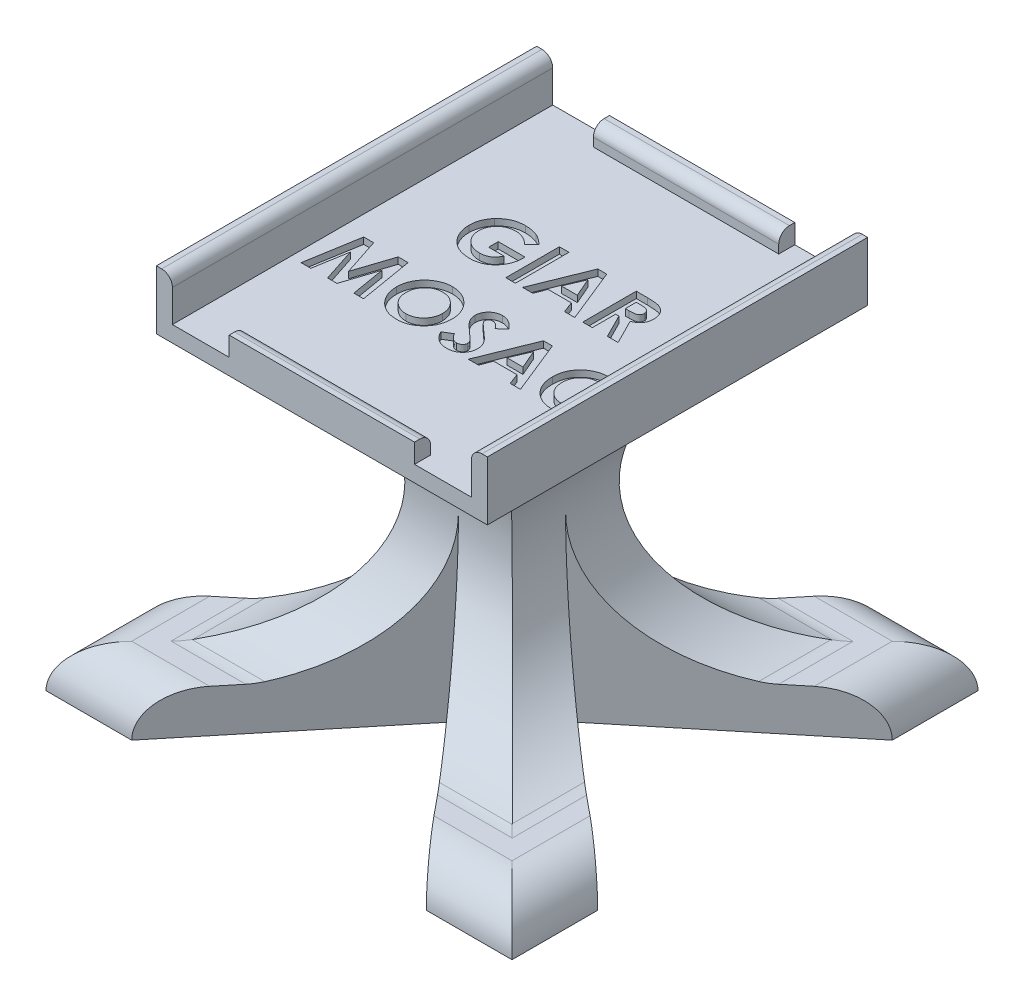
from build123d import *

# Parameters (mm, degrees)
SKETCH1_W                      = 154.5
SKETCH1_H                      = 177.5
SKETCH1_W_2                    = 139.5
SKETCH1_H_2                    = 162.5
BOSS_EXTRUDE1_DEPTH            = 7.5
BOSS_EXTRUDE2_START            = 7.5
SKETCH1_3_W                    = 154.5
SKETCH1_3_H                    = 177.5
SKETCH1_3_W_2                  = 139.5
SKETCH1_3_H_2                  = 162.5
BOSS_EXTRUDE2_DEPTH            = 20
CUT_EXTRUDE4_REACH             = 190.743
SKETCH5_W                      = 26.5
SKETCH5_H                      = 20
CUT_EXTRUDE4_DIRECTION_2_REACH = 190.743
SKETCH6_W                      = 86.5
SKETCH6_H                      = 7.5
CUT_EXTRUDE5_DEPTH             = 11
SKETCH7_W                      = 4.487179487
SKETCH7_H                      = 25
CUT_EXTRUDE6_DEPTH             = 3
FILLET2_R                      = 5
SKETCH1_4_W                    = 154.5
SKETCH1_4_H                    = 177.5
SKETCH1_4_W_2                  = 139.5
SKETCH1_4_H_2                  = 162.5
BOSS_EXTRUDE3_DEPTH            = 150
CUT_EXTRUDE1_REACH             = 246.896
CUT_EXTRUDE2_DEPTH             = 233.909451328
CUT_EXTRUDE3_REACH             = 214.956
BOSS_EXTRUDE4_DEPTH            = 20
FILLET1_R                      = 20


with BuildPart() as part:
    # Sketch1 → Boss-Extrude1 (new body)
    # profile 1 of 2: a face of its own
    with BuildSketch(Plane(origin=(0, 0, 0), x_dir=(1, 0, 0), z_dir=(0, 1, 0))):
        Rectangle(SKETCH1_W, SKETCH1_H)
        Rectangle(SKETCH1_W_2, SKETCH1_H_2, mode=Mode.SUBTRACT)
    # profile 2 of 2: a face of its own
    with BuildSketch(Plane(origin=(0, 0, 0), x_dir=(1, 0, 0), z_dir=(0, 1, 0))):
        Rectangle(SKETCH1_W_2, SKETCH1_H_2)
    extrude(amount=BOSS_EXTRUDE1_DEPTH)

    # Sketch1<3> → Boss-Extrude2 (add)
    with BuildSketch(Plane(origin=(0, 0, 0), x_dir=(1, 0, 0), z_dir=(0, 1, 0)).offset(BOSS_EXTRUDE2_START)):
        Rectangle(SKETCH1_3_W, SKETCH1_3_H)
        Rectangle(SKETCH1_3_W_2, SKETCH1_3_H_2, mode=Mode.SUBTRACT)
    extrude(amount=BOSS_EXTRUDE2_DEPTH)

    # Sketch5 → Cut-Extrude4 (cut, up to next)
    with BuildSketch(Plane.XY.offset(-81.25), mode=Mode.PRIVATE) as cut_extrude4_sk1:
        with Locations((-56.5, 17.5)):
            Rectangle(SKETCH5_W, SKETCH5_H)
    cut_extrude4_tool1 = extrude(cut_extrude4_sk1.sketch, amount=-CUT_EXTRUDE4_REACH, mode=Mode.PRIVATE) & part.part
    # Sketch5 → Cut-Extrude4 (cut, up to next)
    with BuildSketch(Plane.XY.offset(-81.25), mode=Mode.PRIVATE) as cut_extrude4_sk2:
        with Locations((56.5, 17.5)):
            Rectangle(SKETCH5_W, SKETCH5_H)
    cut_extrude4_tool2 = extrude(cut_extrude4_sk2.sketch, amount=-CUT_EXTRUDE4_REACH, mode=Mode.PRIVATE) & part.part
    add(cut_extrude4_tool1.solids().sort_by_distance((-56.5, 17.5, -81.25))[0], mode=Mode.SUBTRACT)
    add(cut_extrude4_tool2.solids().sort_by_distance((56.5, 17.5, -81.25))[0], mode=Mode.SUBTRACT)

    # Sketch5 → Cut-Extrude4 direction 2 (cut, up to next)
    with BuildSketch(Plane.XY.offset(-81.25), mode=Mode.PRIVATE) as cut_extrude4_direction_2_sk1:
        with Locations((-56.5, 17.5)):
            Rectangle(SKETCH5_W, SKETCH5_H)
    cut_extrude4_direction_2_tool1 = extrude(cut_extrude4_direction_2_sk1.sketch, amount=CUT_EXTRUDE4_DIRECTION_2_REACH, mode=Mode.PRIVATE) & part.part
    # Sketch5 → Cut-Extrude4 direction 2 (cut, up to next)
    with BuildSketch(Plane.XY.offset(-81.25), mode=Mode.PRIVATE) as cut_extrude4_direction_2_sk2:
        with Locations((56.5, 17.5)):
            Rectangle(SKETCH5_W, SKETCH5_H)
    cut_extrude4_direction_2_tool2 = extrude(cut_extrude4_direction_2_sk2.sketch, amount=CUT_EXTRUDE4_DIRECTION_2_REACH, mode=Mode.PRIVATE) & part.part
    add(cut_extrude4_direction_2_tool1.solids().sort_by_distance((-56.5, 17.5, -81.25))[0], mode=Mode.SUBTRACT)
    add(cut_extrude4_direction_2_tool2.solids().sort_by_distance((56.5, 17.5, -81.25))[0], mode=Mode.SUBTRACT)

    # Sketch6 → Cut-Extrude5 (cut)
    with BuildSketch(Plane(origin=(0, 27.5, 0), x_dir=(1, 0, 0), z_dir=(0, 1, 0))):
        with Locations((0, 85)):
            Rectangle(SKETCH6_W, SKETCH6_H)
        with Locations((0, -85)):
            Rectangle(SKETCH6_W, SKETCH6_H)
    extrude(amount=-CUT_EXTRUDE5_DEPTH, mode=Mode.SUBTRACT)

    # Sketch7 → Cut-Extrude6 (cut)
    # profile 1 of 9: a face of its own
    with BuildSketch(Plane(origin=(0, 7.5, 0), x_dir=(1, 0, 0), z_dir=(0, 1, 0))):
        with BuildLine():
            Line((-16.511418269, 29.023637821), (-19.906850962, 25.7734375))
            add(Edge.make_bspline(
                [(-19.906850962, 25.7734375), (-20.175673293, 26.042581928), (-20.703147087, 26.570687729), (-21.565764494, 27.258053723), (-22.45917433, 27.842450703), (-23.386317167, 28.322982778), (-24.348484518, 28.695725235), (-25.343777618, 28.96235984), (-26.373815678, 29.120505342), (-27.071105468, 29.142645174), (-27.423878205, 29.153846154)],
                knots=[0, 0, 0, 0, 1.075575784, 2.110457258, 3.113929901, 4.09197124, 5.059417775, 6.02750972, 7.002078037, 8, 8, 8, 8], degree=3))
            add(Edge.make_bspline(
                [(-27.423878205, 29.153846154), (-27.729721383, 29.145997678), (-28.330271272, 29.130586507), (-29.212721495, 29.013555131), (-30.055956738, 28.818059481), (-30.863960793, 28.5472329), (-31.631800515, 28.194801921), (-32.36392491, 27.766205903), (-33.055828479, 27.25816605), (-33.702062979, 26.680313032), (-34.290461571, 26.049414206), (-34.804164611, 25.374129373), (-35.24172924, 24.667045269), (-35.60193417, 23.924544347), (-35.876010951, 23.1477662), (-36.071665907, 22.337274728), (-36.195858152, 21.495425332), (-36.210521546, 20.921106955), (-36.217948718, 20.630208333)],
                knots=[0, 0, 0, 0, 1.075001177, 2.110859044, 3.123021556, 4.114053297, 5.101481495, 6.087880186, 7.091499647, 8.114004866, 9.131394192, 10.11971144, 11.092043119, 12.050101265, 13.015322563, 13.981809771, 14.977764287, 16, 16, 16, 16], degree=3))
            add(Edge.make_bspline(
                [(-36.217948718, 20.630208333), (-36.211021008, 20.32924132), (-36.19737247, 19.736295103), (-36.066262834, 18.866121038), (-35.864265867, 18.028950884), (-35.568596166, 17.230996248), (-35.204716308, 16.461326264), (-34.743256695, 15.734850176), (-34.205148608, 15.040473894), (-33.591353572, 14.390286909), (-32.92370308, 13.790970985), (-32.200615876, 13.273985642), (-31.444092704, 12.827938887), (-30.641923246, 12.474684275), (-29.808030789, 12.19105952), (-28.933957268, 11.991079728), (-28.021670888, 11.86839282), (-27.399226115, 11.853640631), (-27.083333333, 11.846153846)],
                knots=[0, 0, 0, 0, 1.022067601, 2.013613092, 2.983553406, 3.943623673, 4.90013463, 5.87121881, 6.861774014, 7.881098904, 8.905697761, 9.905387765, 10.89678721, 11.884561068, 12.87834324, 13.885584958, 14.926927371, 16, 16, 16, 16], degree=3))
            add(Edge.make_bspline(
                [(-27.083333333, 11.846153846), (-26.877856777, 11.848007826), (-26.474460577, 11.8516476), (-25.882747096, 11.91073137), (-25.316027705, 11.995198488), (-24.772107656, 12.107022922), (-24.256479082, 12.265274562), (-23.762002752, 12.450330367), (-23.291575863, 12.668733117), (-22.847749019, 12.928018111), (-22.42391679, 13.218644896), (-22.024046327, 13.55118374), (-21.641123433, 13.918137117), (-21.279622512, 14.323987879), (-20.945662074, 14.772364815), (-20.628542872, 15.255028398), (-20.331895866, 15.776768773), (-20.156614977, 16.145195397), (-20.067107372, 16.333333333)],
                knots=[0, 0, 0, 0, 1.109579412, 2.178351274, 3.208885622, 4.204702371, 5.174744997, 6.119429583, 7.05542196, 7.97267548, 8.893247984, 9.828544973, 10.778894627, 11.756245826, 12.760884819, 13.796418446, 14.874735809, 16, 16, 16, 16], degree=3))
            Line((-20.067107372, 16.333333333), (-27.243589744, 16.333333333))
            Line((-27.243589744, 16.333333333), (-27.243589744, 20.820512821))
            Line((-27.243589744, 20.820512821), (-14.778645833, 20.820512821))
            Line((-14.778645833, 20.820512821), (-14.743589744, 19.75380609))
            add(Edge.make_bspline(
                [(-14.743589744, 19.75380609), (-14.74809419, 19.479848736), (-14.757095045, 18.932422929), (-14.839353417, 18.11739916), (-14.975613157, 17.313184991), (-15.161893264, 16.520588155), (-15.395349361, 15.73572068), (-15.693078965, 14.966098326), (-16.041718511, 14.206501769), (-16.432344388, 13.460158708), (-16.871295481, 12.744022248), (-17.343890786, 12.065935556), (-17.843393134, 11.427072254), (-18.380666495, 10.836333308), (-18.947344639, 10.28875625), (-19.544543077, 9.786447675), (-20.17437407, 9.328982567), (-20.833501153, 8.912496392), (-21.525678687, 8.547470833), (-22.247101084, 8.229947022), (-22.996679093, 7.960280754), (-23.776347949, 7.739213077), (-24.584573458, 7.568641777), (-25.421372935, 7.451680813), (-26.287205959, 7.372204523), (-26.874482184, 7.363437729), (-27.173477564, 7.358974359)],
                knots=[0, 0, 0, 0, 1.006889344, 2.011981806, 3.007738725, 4.003571281, 5.003404394, 6.015442001, 7.03424805, 8.074616296, 9.110249922, 10.119753985, 11.111721717, 12.089233633, 13.052717867, 14.006597561, 14.955430184, 15.912305663, 16.870361111, 17.829300583, 18.807640451, 19.796414044, 20.806216501, 21.841577364, 22.90109906, 24, 24, 24, 24], degree=3))
            add(Edge.make_bspline(
                [(-27.173477564, 7.358974359), (-27.492485363, 7.36338202), (-28.124853968, 7.372119317), (-29.059895704, 7.453950059), (-29.967811296, 7.589006416), (-30.848827202, 7.775919798), (-31.704988962, 8.008548433), (-32.534825557, 8.300552398), (-33.336639749, 8.647900348), (-34.112832595, 9.041394376), (-34.853483504, 9.487650879), (-35.55693256, 9.978844699), (-36.219340203, 10.518135457), (-36.84749154, 11.096495313), (-37.426710531, 11.728140405), (-37.978582401, 12.392596052), (-38.476370847, 13.114231836), (-38.941479298, 13.869652114), (-39.35468536, 14.658540324), (-39.716040003, 15.466305573), (-40.024203037, 16.288270894), (-40.267197038, 17.128263636), (-40.464485409, 17.980426664), (-40.605648942, 18.848465839), (-40.685370584, 19.732272501), (-40.698513094, 20.326236359), (-40.705128205, 20.625200321)],
                knots=[0, 0, 0, 0, 1.084149091, 2.14910686, 3.187506334, 4.202448172, 5.208724393, 6.201130722, 7.189831603, 8.176984443, 9.156919086, 10.126598231, 11.090766514, 12.05840148, 13.026036446, 14.001772938, 14.991905635, 16.003017641, 17.015720547, 18.016462227, 19.009322657, 19.99686681, 20.986544154, 21.980959929, 22.983742515, 24, 24, 24, 24], degree=3))
            add(Edge.make_bspline(
                [(-40.705128205, 20.625200321), (-40.696269159, 21.03305105), (-40.678775169, 21.838435322), (-40.516754275, 23.024771464), (-40.26418784, 24.17243331), (-39.901729577, 25.277241153), (-39.436610034, 26.340716877), (-38.87541805, 27.365357044), (-38.205963317, 28.350072551), (-37.687759374, 28.959748213), (-37.424879808, 29.269030449)],
                knots=[0, 0, 0, 0, 1.034044851, 2.041932006, 3.031217818, 4.011390712, 4.986069675, 5.97149666, 6.970960976, 8, 8, 8, 8], degree=3))
            add(Edge.make_bspline(
                [(-37.424879808, 29.269030449), (-37.261660453, 29.447959596), (-36.937672489, 29.803131263), (-36.419778318, 30.296649521), (-35.888750205, 30.760574941), (-35.337233327, 31.185070277), (-34.768126907, 31.579427934), (-34.179792954, 31.936255365), (-33.575317734, 32.266914143), (-32.949987071, 32.554519578), (-32.307074659, 32.812381843), (-31.643733138, 33.030569575), (-30.964930801, 33.223832046), (-30.264656831, 33.370855219), (-29.549985665, 33.493284897), (-28.815844327, 33.575343679), (-28.064233399, 33.635486925), (-27.555881569, 33.639164799), (-27.298677885, 33.641025641)],
                knots=[0, 0, 0, 0, 1.020590567, 2.025856924, 3.013483481, 3.991664875, 4.957826714, 5.930500614, 6.890802512, 7.860442893, 8.829981142, 9.809047939, 10.802672283, 11.803273349, 12.823572789, 13.857849586, 14.916166035, 16, 16, 16, 16], degree=3))
            add(Edge.make_bspline(
                [(-27.298677885, 33.641025641), (-27.029816529, 33.636879336), (-26.494881155, 33.628629713), (-25.69952084, 33.571547702), (-24.91521259, 33.483483613), (-24.145261556, 33.35138245), (-23.38708378, 33.188474222), (-22.64460377, 32.979748461), (-21.912977764, 32.742598399), (-21.436692005, 32.553524849), (-21.198918269, 32.459134615)],
                knots=[0, 0, 0, 0, 1.03180557, 2.052914215, 3.058998889, 4.059601663, 5.049854447, 6.033765722, 7.018406786, 8, 8, 8, 8], degree=3))
            add(Edge.make_bspline(
                [(-21.198918269, 32.459134615), (-20.998861083, 32.371901049), (-20.591950302, 32.194470388), (-19.999945268, 31.869852673), (-19.406493802, 31.509976679), (-18.81799955, 31.101684504), (-18.23535921, 30.645739844), (-17.652489398, 30.149344268), (-17.075340258, 29.606709518), (-16.701826662, 29.220512117), (-16.511418269, 29.023637821)],
                knots=[0, 0, 0, 0, 0.894392155, 1.819168899, 2.76525314, 3.739198753, 4.75366411, 5.797420238, 6.877176959, 8, 8, 8, 8], degree=3))
        make_face()
    # profile 2 of 9: a face of its own
    with BuildSketch(Plane(origin=(0, 7.5, 0), x_dir=(1, 0, 0), z_dir=(0, 1, 0))):
        with Locations((-8.653846154, 20.5)):
            Rectangle(SKETCH7_W, SKETCH7_H)
    # profile 3 of 9: a face of its own
    with BuildSketch(Plane(origin=(0, 7.5, 0), x_dir=(1, 0, 0), z_dir=(0, 1, 0))):
        Polygon((7.056290064, 33), (11.217948718, 33), (21.314102564, 8), (16.521434295, 8), (14.578325321, 13.128205128), (3.685897436, 13.128205128), (1.742788462, 8), (-3.044871795, 8), align=None)
        Polygon((9.134615385, 26.294270833), (5.388621795, 17.615384615), (12.880608974, 17.615384615), align=None, mode=Mode.SUBTRACT)
    # profile 4 of 9: a face of its own
    with BuildSketch(Plane(origin=(0, 7.5, 0), x_dir=(1, 0, 0), z_dir=(0, 1, 0))):
        with BuildLine():
            Line((25, 33), (30.228365385, 33))
            add(Edge.make_bspline(
                [(30.228365385, 33), (30.573958745, 32.998773342), (31.238632126, 32.996414133), (32.197054837, 32.959192064), (33.077497901, 32.907394499), (33.881264895, 32.828350041), (34.608011954, 32.723546644), (35.258467447, 32.600000781), (35.832612363, 32.459193783), (36.335288822, 32.283737155), (36.788929468, 32.085824738), (37.211785619, 31.858419741), (37.61318611, 31.604054392), (37.990448011, 31.31603565), (38.346849818, 30.999544901), (38.683063904, 30.654263565), (38.994339252, 30.277263799), (39.278748433, 29.870927764), (39.537964508, 29.443471573), (39.767057151, 28.994308325), (39.953355669, 28.523125659), (40.117970381, 28.036733181), (40.236537025, 27.528177816), (40.318998391, 27.002410437), (40.379373378, 26.457580286), (40.382844651, 26.087446872), (40.384615385, 25.898637821)],
                knots=[0, 0, 0, 0, 1.749336639, 3.364467119, 4.854658419, 6.213483162, 7.451590619, 8.570285859, 9.5643256, 10.440900261, 11.26203566, 12.067320669, 12.869050712, 13.665104639, 14.467235401, 15.27997916, 16.102287765, 16.939272006, 17.78853747, 18.631303466, 19.488103222, 20.351255419, 21.228522269, 22.127379805, 23.044756219, 24, 24, 24, 24], degree=3))
            add(Edge.make_bspline(
                [(40.384615385, 25.898637821), (40.380015655, 25.701564545), (40.370996423, 25.31513977), (40.322413933, 24.747513292), (40.233620404, 24.204447981), (40.099129685, 23.687533867), (39.944550073, 23.190337349), (39.738998841, 22.722032016), (39.50701396, 22.275807044), (39.231492294, 21.857974455), (38.929120727, 21.459253351), (38.577468954, 21.094920219), (38.199318609, 20.74539353), (37.773412485, 20.432566452), (37.318524918, 20.135286748), (36.825617773, 19.865872167), (36.297907928, 19.617550247), (35.926901774, 19.479068792), (35.737179487, 19.408253205)],
                knots=[0, 0, 0, 0, 1.099860209, 2.156625411, 3.176576793, 4.16617041, 5.135385252, 6.078461593, 7.016046972, 7.938469504, 8.868247731, 9.803980173, 10.76021508, 11.73834243, 12.748633912, 13.790971185, 14.870363756, 16, 16, 16, 16], degree=3))
            Line((35.737179487, 19.408253205), (41.506410256, 8))
            Line((41.506410256, 8), (36.518429487, 8))
            Line((36.518429487, 8), (31.009615385, 18.897435897))
            Line((31.009615385, 18.897435897), (29.487179487, 18.897435897))
            Line((29.487179487, 18.897435897), (29.487179487, 8))
            Line((29.487179487, 8), (25, 8))
            Line((25, 8), (25, 33))
        make_face()
        with BuildLine():
            Line((29.487179487, 23.384615385), (31.234975962, 23.384615385))
            add(Edge.make_bspline(
                [(31.234975962, 23.384615385), (31.448658609, 23.387022022), (31.857814965, 23.391630216), (32.446235543, 23.413004929), (32.980661758, 23.464507426), (33.463388618, 23.529578907), (33.89684516, 23.604713328), (34.277165105, 23.712385515), (34.610208601, 23.827758989), (34.892029072, 23.971138289), (35.132810007, 24.134191651), (35.340708933, 24.319424324), (35.512671154, 24.533807556), (35.654204833, 24.771515337), (35.764302648, 25.034650133), (35.844665618, 25.32032332), (35.889576635, 25.631789084), (35.8947438, 25.846742871), (35.897435897, 25.958733974)],
                knots=[0, 0, 0, 0, 1.688639943, 3.233382647, 4.650958383, 5.928841754, 7.082724185, 8.122798841, 9.049171256, 9.863274652, 10.613301712, 11.341792392, 12.054588806, 12.776240173, 13.521029143, 14.301969904, 15.115324896, 16, 16, 16, 16], degree=3))
            add(Edge.make_bspline(
                [(35.897435897, 25.958733974), (35.89234624, 26.091227625), (35.882348552, 26.35148685), (35.783140428, 26.726168876), (35.625222523, 27.072962726), (35.408760328, 27.390301499), (35.136154336, 27.668502575), (34.823317451, 27.913739039), (34.4634979, 28.107653684), (34.130332072, 28.23555772), (33.827229044, 28.312084024), (33.553688124, 28.369110749), (33.236926091, 28.409527226), (32.876703808, 28.452396094), (32.473939493, 28.480194384), (32.026437841, 28.500481596), (31.535484072, 28.508782091), (31.193242666, 28.511435613), (31.014623397, 28.512820513)],
                knots=[0, 0, 0, 0, 1.020303359, 2.004196876, 2.966617323, 3.9489082, 4.950758222, 5.960522915, 7.003732012, 8.091992268, 8.70421221, 9.413913587, 10.24622431, 11.166358409, 12.212345909, 13.359657661, 14.621978493, 16, 16, 16, 16], degree=3))
            Line((31.014623397, 28.512820513), (29.487179487, 28.512820513))
            Line((29.487179487, 28.512820513), (29.487179487, 23.384615385))
        make_face(mode=Mode.SUBTRACT)
    # profile 5 of 9: a face of its own
    with BuildSketch(Plane(origin=(0, 7.5, 0), x_dir=(1, 0, 0), z_dir=(0, 1, 0))):
        Polygon((-60.521834936, -8.705128205), (-55.864383013, -8.705128205), (-50.16025641, -26.143028846), (-44.416065705, -8.705128205), (-39.803685897, -8.705128205), (-35.576923077, -33.705128205), (-40.119190705, -33.705128205), (-42.788461538, -17.914863782), (-47.986778846, -33.705128205), (-52.363782051, -33.705128205), (-57.532051282, -17.914863782), (-60.196314103, -33.705128205), (-64.743589744, -33.705128205), align=None)
    # profile 6 of 9: a face of its own
    with BuildSketch(Plane(origin=(0, 7.5, 0), x_dir=(1, 0, 0), z_dir=(0, 1, 0))):
        with BuildLine():
            add(Edge.make_bspline(
                [(-19.661458333, -8.064102564), (-19.226802694, -8.075356577), (-18.368694015, -8.097574547), (-17.106725807, -8.282778671), (-15.890586102, -8.584542239), (-14.720824835, -9.004015424), (-13.600370952, -9.552559693), (-12.525272238, -10.214623455), (-11.499379646, -11.002702768), (-10.533205701, -11.898413041), (-9.640286722, -12.872458851), (-8.866571906, -13.921192338), (-8.206776295, -15.017439763), (-7.659935927, -16.164138553), (-7.243415203, -17.369230144), (-6.951125383, -18.626570161), (-6.763343655, -19.935800903), (-6.741745867, -20.827208589), (-6.730769231, -21.280248397)],
                knots=[0, 0, 0, 0, 1.014329547, 2.002516266, 2.970391464, 3.935626869, 4.897733899, 5.877609409, 6.878433252, 7.912639331, 8.949961323, 9.958554974, 10.949718813, 11.932905612, 12.9188844, 13.919928257, 14.942845884, 16, 16, 16, 16], degree=3))
            add(Edge.make_bspline(
                [(-6.730769231, -21.280248397), (-6.742458873, -21.728183494), (-6.765493689, -22.610853972), (-6.943459311, -23.908019638), (-7.240671328, -25.151890924), (-7.650127534, -26.345283362), (-8.187050285, -27.482416567), (-8.833979163, -28.570550978), (-9.607985391, -29.599588446), (-10.480837924, -30.568976751), (-11.441772813, -31.448904646), (-12.459555407, -32.224339584), (-13.529486214, -32.881413887), (-14.649999198, -33.419826585), (-15.823497245, -33.83766885), (-17.047081671, -34.132486931), (-18.320676761, -34.311653831), (-19.186783184, -34.334538185), (-19.626402244, -34.346153846)],
                knots=[0, 0, 0, 0, 1.051557043, 2.072126891, 3.067553643, 4.050577992, 5.02905126, 6.015227836, 7.017913613, 8.04756643, 9.074058332, 10.072836633, 11.047628519, 12.017157415, 12.98668631, 13.966869689, 14.968021931, 16, 16, 16, 16], degree=3))
            add(Edge.make_bspline(
                [(-19.626402244, -34.346153846), (-20.086191067, -34.335734026), (-20.989613257, -34.315260503), (-22.311775677, -34.120566651), (-23.57852152, -33.827289698), (-24.779209391, -33.389589578), (-25.92606727, -32.842427624), (-27.010668855, -32.168564873), (-28.03264965, -31.369114935), (-28.986147404, -30.46455202), (-29.850018679, -29.474761791), (-30.612554527, -28.429136187), (-31.255770431, -27.33566287), (-31.779689924, -26.193830069), (-32.192727007, -25.010733998), (-32.484077739, -23.77916926), (-32.656185569, -22.502089596), (-32.68015919, -21.634671559), (-32.692307692, -21.195112179)],
                knots=[0, 0, 0, 0, 1.067978421, 2.098431617, 3.099715153, 4.085208694, 5.062210972, 6.048429807, 7.046490867, 8.072918869, 9.098532598, 10.095778865, 11.076610158, 12.041847152, 13.011192615, 13.984257998, 14.978533688, 16, 16, 16, 16], degree=3))
            add(Edge.make_bspline(
                [(-32.692307692, -21.195112179), (-32.688494792, -20.89939964), (-32.680917273, -20.31171896), (-32.589638065, -19.440806191), (-32.458222249, -18.58689247), (-32.263864494, -17.753382364), (-32.027769497, -16.934395845), (-31.721875077, -16.137556244), (-31.373684445, -15.354351123), (-30.966856475, -14.594031113), (-30.514503109, -13.863591796), (-30.020945313, -13.16647878), (-29.484942042, -12.511121181), (-28.90821994, -11.893212259), (-28.288791545, -11.316813574), (-27.634804797, -10.7737654), (-26.933576162, -10.278493028), (-26.200453333, -9.818900918), (-25.43956949, -9.403299744), (-24.65402212, -9.049552454), (-23.85999505, -8.740630971), (-23.046881149, -8.496816477), (-22.223394379, -8.298232122), (-21.380737452, -8.166904881), (-20.526523295, -8.075628201), (-19.950497645, -8.067953561), (-19.661458333, -8.064102564)],
                knots=[0, 0, 0, 0, 1.034744296, 2.056386356, 3.06226378, 4.057406941, 5.050368692, 6.043467995, 7.042652155, 8.049140477, 9.059438543, 10.048523776, 11.036952808, 12.020949711, 13.004946614, 13.997082645, 14.994316842, 16.007702937, 17.024872941, 18.026463647, 19.021641123, 20.005082605, 20.995858141, 21.984425357, 22.988620895, 24, 24, 24, 24], degree=3))
        make_face()
        with BuildLine():
            add(Edge.make_bspline(
                [(-19.731570513, -12.551282051), (-20.0240937, -12.559131105), (-20.601417416, -12.574621997), (-21.448246166, -12.692641638), (-22.261231672, -12.88113242), (-23.035867233, -13.154159015), (-23.775510189, -13.501652576), (-24.481471695, -13.922398918), (-25.143975646, -14.430860725), (-25.771855891, -14.999740952), (-26.339042373, -15.633604262), (-26.840169522, -16.312896597), (-27.259532231, -17.036483553), (-27.610751127, -17.797643176), (-27.875141114, -18.604934505), (-28.063458175, -19.452033939), (-28.182467528, -20.340401075), (-28.197468805, -20.945999794), (-28.205128205, -21.255208333)],
                knots=[0, 0, 0, 0, 1.033739768, 2.040188636, 3.016340934, 3.979330865, 4.937572243, 5.900995986, 6.878200029, 7.884839167, 8.891893314, 9.879764717, 10.863503415, 11.843163062, 12.837761627, 13.859916423, 14.907309254, 16, 16, 16, 16], degree=3))
            add(Edge.make_bspline(
                [(-28.205128205, -21.255208333), (-28.19497301, -21.59788095), (-28.17507051, -22.269462501), (-28.0350341, -23.249147574), (-27.795445743, -24.174362891), (-27.449484813, -25.040583364), (-27.020402496, -25.857427721), (-26.487550359, -26.614884373), (-25.859558082, -27.317488619), (-25.37575792, -27.727698243), (-25.130208333, -27.935897436)],
                knots=[0, 0, 0, 0, 1.078454662, 2.113592447, 3.107694534, 4.079536787, 5.043276885, 6.005368276, 6.987637804, 8, 8, 8, 8], degree=3))
            add(Edge.make_bspline(
                [(-25.130208333, -27.935897436), (-24.929056344, -28.089707003), (-24.531284353, -28.393860783), (-23.896353655, -28.783696246), (-23.242500059, -29.117824127), (-22.564789421, -29.387795502), (-21.86465303, -29.600150448), (-21.142186897, -29.748859125), (-20.398414695, -29.84218668), (-19.895441076, -29.853341091), (-19.641426282, -29.858974359)],
                knots=[0, 0, 0, 0, 1.023928204, 2.024787132, 3.009472467, 3.9914905, 4.972207045, 5.96565515, 6.972602802, 8, 8, 8, 8], degree=3))
            add(Edge.make_bspline(
                [(-19.641426282, -29.858974359), (-19.353933038, -29.851058754), (-18.788281038, -29.835484552), (-17.957216462, -29.718917797), (-17.161031357, -29.521644761), (-16.394782939, -29.251013252), (-15.660680724, -28.899156609), (-14.962312472, -28.465360036), (-14.298453751, -27.954949995), (-13.671373418, -27.378599125), (-13.09819235, -26.742238832), (-12.598110949, -26.059323221), (-12.165414602, -25.344898967), (-11.821499308, -24.588854477), (-11.54666387, -23.798326458), (-11.360613303, -22.969813831), (-11.240598591, -22.106732041), (-11.225593087, -21.519374381), (-11.217948718, -21.220152244)],
                knots=[0, 0, 0, 0, 1.026359118, 2.019393844, 2.989460624, 3.950973911, 4.916101784, 5.890408035, 6.881132271, 7.902007068, 8.92769091, 9.933912415, 10.920395702, 11.90457117, 12.894218921, 13.903490204, 14.931958862, 16, 16, 16, 16], degree=3))
            add(Edge.make_bspline(
                [(-11.217948718, -21.220152244), (-11.225857583, -20.922650716), (-11.241424979, -20.33706433), (-11.358196898, -19.476201516), (-11.55421888, -18.65134653), (-11.825663066, -17.861152295), (-12.172282919, -17.104844129), (-12.60091353, -16.385081657), (-13.110050888, -15.702560714), (-13.687977229, -15.061932419), (-14.31701453, -14.473236052), (-14.992348926, -13.96235462), (-15.695083802, -13.518414898), (-16.441343325, -13.170650446), (-17.215859649, -12.893587245), (-18.023358915, -12.689553928), (-18.866899575, -12.57545109), (-19.440777728, -12.55941021), (-19.731570513, -12.551282051)],
                knots=[0, 0, 0, 0, 1.055025985, 2.07665775, 3.074803781, 4.057872707, 5.035505728, 6.020516407, 7.023567878, 8.050795229, 9.077271434, 10.074415901, 11.050397877, 12.019801805, 12.988065821, 13.964604439, 14.968634123, 16, 16, 16, 16], degree=3))
        make_face(mode=Mode.SUBTRACT)
    # profile 7 of 9: a face of its own
    with BuildSketch(Plane(origin=(0, 7.5, 0), x_dir=(1, 0, 0), z_dir=(0, 1, 0))):
        with BuildLine():
            Line((10.576923077, -12.045472756), (7.221554487, -15.115384615))
            add(Edge.make_bspline(
                [(7.221554487, -15.115384615), (7.077824884, -14.912639068), (6.80188409, -14.523395891), (6.354612845, -14.002190104), (5.909361259, -13.557562779), (5.462004347, -13.191371365), (5.008576906, -12.905840747), (4.549866022, -12.703681915), (4.088472255, -12.575167627), (3.778486866, -12.559164506), (3.625801282, -12.551282051)],
                knots=[0, 0, 0, 0, 1.299362458, 2.494594718, 3.587462134, 4.587049575, 5.512617175, 6.380583204, 7.202344345, 8, 8, 8, 8], degree=3))
            add(Edge.make_bspline(
                [(3.625801282, -12.551282051), (3.483380549, -12.556276736), (3.208403533, -12.565920161), (2.816403395, -12.661775082), (2.468380091, -12.827206598), (2.164673275, -13.043522224), (1.924092668, -13.304132402), (1.73200771, -13.577445471), (1.623847738, -13.879121287), (1.609611757, -14.086324408), (1.602564103, -14.188902244)],
                knots=[0, 0, 0, 0, 1.185010067, 2.2879431, 3.333075148, 4.379039566, 5.372662701, 6.27520591, 7.14612461, 8, 8, 8, 8], degree=3))
            add(Edge.make_bspline(
                [(1.602564103, -14.188902244), (1.606980511, -14.292959298), (1.615874543, -14.502515743), (1.701778784, -14.809646813), (1.831261006, -15.109749621), (1.954986554, -15.29243648), (2.018229167, -15.385817308)],
                knots=[0, 0, 0, 0, 0.967525499, 1.948461899, 2.951351359, 4, 4, 4, 4], degree=3))
            add(Edge.make_bspline(
                [(2.018229167, -15.385817308), (2.075723542, -15.458401248), (2.208068003, -15.625479893), (2.460421782, -15.890106423), (2.777325131, -16.214297085), (3.170973156, -16.586903912), (3.625024446, -17.021327304), (4.160524865, -17.500489911), (4.762060375, -18.039230842), (5.189617879, -18.414390518), (5.413661859, -18.610977564)],
                knots=[0, 0, 0, 0, 0.473873513, 1.090794244, 1.870441696, 2.795289791, 3.865433203, 5.087734844, 6.473946851, 8, 8, 8, 8], degree=3))
            add(Edge.make_bspline(
                [(5.413661859, -18.610977564), (5.623959362, -18.792979446), (6.023060333, -19.138381205), (6.59090176, -19.628623544), (7.089939801, -20.069682624), (7.527444302, -20.454939089), (7.896783121, -20.788435164), (8.19950896, -21.071764955), (8.439319102, -21.299412553), (8.575637127, -21.436911841), (8.633814103, -21.495592949)],
                knots=[0, 0, 0, 0, 1.543621617, 2.929473131, 4.163658386, 5.240097082, 6.164993805, 6.925417477, 7.541396219, 8, 8, 8, 8], degree=3))
            add(Edge.make_bspline(
                [(8.633814103, -21.495592949), (8.85452542, -21.734449864), (9.278810083, -22.193616738), (9.830230575, -22.905180987), (10.284067476, -23.599812785), (10.635164309, -24.290582756), (10.900326759, -24.987457336), (11.087269798, -25.707527336), (11.199231228, -26.458317037), (11.211661561, -26.970639353), (11.217948718, -27.229767628)],
                knots=[0, 0, 0, 0, 1.206664779, 2.319633467, 3.337109185, 4.282041471, 5.190008762, 6.099243693, 7.03861361, 8, 8, 8, 8], degree=3))
            add(Edge.make_bspline(
                [(11.217948718, -27.229767628), (11.213473681, -27.482256353), (11.204693491, -27.977648627), (11.097153008, -28.70258143), (10.943806591, -29.396373584), (10.706706128, -30.051475651), (10.417729488, -30.678640932), (10.055455534, -31.268100184), (9.63001445, -31.825818978), (9.142393644, -32.341827407), (8.60302713, -32.810069291), (8.024505283, -33.226909275), (7.401171026, -33.571063778), (6.738350028, -33.854450463), (6.036397082, -34.072718677), (5.296148426, -34.234039229), (4.516471799, -34.330861282), (3.983317686, -34.340982879), (3.7109375, -34.346153846)],
                knots=[0, 0, 0, 0, 1.043214005, 2.046824704, 3.02475056, 3.976699089, 4.921714032, 5.875962561, 6.831408892, 7.817874052, 8.806269674, 9.781291748, 10.760897367, 11.74438705, 12.757449933, 13.795994037, 14.874007457, 16, 16, 16, 16], degree=3))
            add(Edge.make_bspline(
                [(3.7109375, -34.346153846), (3.497121373, -34.342360606), (3.073642818, -34.334847814), (2.44949945, -34.273512123), (1.846818474, -34.174522844), (1.266278754, -34.032641637), (0.705264857, -33.852858904), (0.163753742, -33.633261183), (-0.354516358, -33.370444791), (-0.853466921, -33.069814278), (-1.330672433, -32.720742653), (-1.792166968, -32.33036657), (-2.233366525, -31.892681871), (-2.656390096, -31.408723663), (-3.058531059, -30.877121492), (-3.452952929, -30.305278903), (-3.822126412, -29.682583274), (-4.050181295, -29.245757253), (-4.166666667, -29.022636218)],
                knots=[0, 0, 0, 0, 1.016823716, 2.013894106, 2.979844003, 3.91962641, 4.853723003, 5.779685073, 6.695824784, 7.614987388, 8.547259901, 9.504950863, 10.487499108, 11.500346958, 12.559593716, 13.656357062, 14.802919212, 16, 16, 16, 16], degree=3))
            Line((-4.166666667, -29.022636218), (-0.220352564, -26.653846154))
            add(Edge.make_bspline(
                [(-0.220352564, -26.653846154), (-0.074646774, -26.907117681), (0.204683679, -27.392660844), (0.678035245, -28.045049623), (1.162959759, -28.603712622), (1.670668241, -29.058775437), (2.194987147, -29.416322842), (2.738449058, -29.671851023), (3.3014358, -29.830022678), (3.684916792, -29.84933909), (3.876201923, -29.858974359)],
                knots=[0, 0, 0, 0, 1.283663364, 2.460892379, 3.537111102, 4.529833553, 5.449777664, 6.316464042, 7.160231139, 8, 8, 8, 8], degree=3))
            add(Edge.make_bspline(
                [(3.876201923, -29.858974359), (4.070766287, -29.851105676), (4.44824949, -29.835839285), (4.987058457, -29.694828234), (5.481058919, -29.473430539), (5.90806927, -29.157526559), (6.269634713, -28.792925352), (6.536490764, -28.387289839), (6.704131534, -27.948402004), (6.721855228, -27.643521645), (6.730769231, -27.490184295)],
                knots=[0, 0, 0, 0, 1.13588714, 2.203786484, 3.234766741, 4.283437687, 5.291419208, 6.222934724, 7.106237994, 8, 8, 8, 8], degree=3))
            add(Edge.make_bspline(
                [(6.730769231, -27.490184295), (6.722537514, -27.347528843), (6.705815571, -27.057737949), (6.582646886, -26.626865488), (6.390096664, -26.196188979), (6.162296173, -25.842936455), (5.930480649, -25.547167692), (5.708812722, -25.290897439), (5.438879825, -25.007763673), (5.121366389, -24.697410235), (4.760467595, -24.357105004), (4.355879432, -23.986881304), (3.902968938, -23.590000364), (3.582850908, -23.319648989), (3.415464744, -23.178285256)],
                knots=[0, 0, 0, 0, 0.916159276, 1.861089862, 2.860218735, 3.940849679, 4.552606315, 5.27541173, 6.11797699, 7.06649574, 8.129236253, 9.306560635, 10.591630461, 12, 12, 12, 12], degree=3))
            add(Edge.make_bspline(
                [(3.415464744, -23.178285256), (3.097256984, -22.909050978), (2.486519978, -22.392308906), (1.623471103, -21.629097133), (0.845786791, -20.915805799), (0.160183958, -20.243617063), (-0.442073037, -19.624944694), (-0.956905447, -19.054763599), (-1.378657605, -18.528675608), (-1.82246081, -17.905559589), (-2.244162587, -17.146249904), (-2.608632591, -16.23271233), (-2.845085346, -15.31929067), (-2.871576589, -14.706069678), (-2.884615385, -14.404246795)],
                knots=[0, 0, 0, 0, 1.345494975, 2.582412109, 3.71882943, 4.751509156, 5.681369928, 6.505683931, 7.230279997, 7.856715994, 8.973648664, 10.023341002, 11.027102913, 12, 12, 12, 12], degree=3))
            add(Edge.make_bspline(
                [(-2.884615385, -14.404246795), (-2.879192567, -14.190210206), (-2.868509033, -13.768535136), (-2.773210267, -13.148523384), (-2.630782629, -12.550264139), (-2.42393681, -11.975940123), (-2.155475912, -11.4262707), (-1.82944058, -10.898565007), (-1.440768102, -10.397679928), (-1.002760458, -9.923947514), (-0.520188177, -9.491009998), (-0.004498369, -9.10889926), (0.541390116, -8.786162975), (1.11413781, -8.518429791), (1.717293791, -8.313497047), (2.346414637, -8.168230503), (3.002402706, -8.081830595), (3.448591631, -8.07008553), (3.67588141, -8.064102564)],
                knots=[0, 0, 0, 0, 1.010766082, 1.991317756, 2.957454644, 3.913069143, 4.869106762, 5.843196583, 6.838735724, 7.860187025, 8.887984031, 9.89767229, 10.887916223, 11.879572884, 12.879850636, 13.892031539, 14.926195476, 16, 16, 16, 16], degree=3))
            add(Edge.make_bspline(
                [(3.67588141, -8.064102564), (3.970437715, -8.074878061), (4.557225199, -8.096343998), (5.424807419, -8.264200605), (6.272225458, -8.528172803), (6.955090795, -8.846626216), (7.498433998, -9.155112189), (7.914855807, -9.439127213), (8.338587413, -9.764481688), (8.773045947, -10.132200892), (9.210158498, -10.549213137), (9.662354265, -11.005591119), (10.123471529, -11.50527901), (10.423124639, -11.862253723), (10.576923077, -12.045472756)],
                knots=[0, 0, 0, 0, 1.282922637, 2.555718331, 3.837320111, 5.142675274, 5.830281639, 6.55870424, 7.337177975, 8.157850921, 9.037902056, 9.96903443, 10.957596896, 12, 12, 12, 12], degree=3))
        make_face()
    # profile 8 of 9: a face of its own
    with BuildSketch(Plane(origin=(0, 7.5, 0), x_dir=(1, 0, 0), z_dir=(0, 1, 0))):
        Polygon((23.40244391, -8.705128205), (27.564102564, -8.705128205), (37.66025641, -33.705128205), (32.867588141, -33.705128205), (30.924479167, -28.576923077), (20.032051282, -28.576923077), (18.088942308, -33.705128205), (13.301282051, -33.705128205), align=None)
        Polygon((25.480769231, -15.410857372), (21.734775641, -24.08974359), (29.226762821, -24.08974359), align=None, mode=Mode.SUBTRACT)
    # profile 9 of 9: a face of its own
    with BuildSketch(Plane(origin=(0, 7.5, 0), x_dir=(1, 0, 0), z_dir=(0, 1, 0))):
        with BuildLine():
            Line((63.782051282, -13.042067308), (60.491786859, -16.187099359))
            add(Edge.make_bspline(
                [(60.491786859, -16.187099359), (60.212679825, -15.898502219), (59.667496348, -15.334781589), (58.789000598, -14.588465154), (57.875397005, -13.966511386), (56.944457902, -13.442705882), (55.979438394, -13.046409687), (54.991496735, -12.757621974), (53.974324626, -12.581559021), (53.285941666, -12.561414303), (52.939703526, -12.551282051)],
                knots=[0, 0, 0, 0, 1.115251505, 2.178435587, 3.19620269, 4.182487026, 5.141301733, 6.088180966, 7.038406374, 8, 8, 8, 8], degree=3))
            add(Edge.make_bspline(
                [(52.939703526, -12.551282051), (52.650552603, -12.559286885), (52.079945114, -12.575083541), (51.242143793, -12.690888614), (50.440743531, -12.887820179), (49.673001008, -13.159228356), (48.941175339, -13.510416132), (48.243732161, -13.941111696), (47.582390991, -14.447425255), (46.965887762, -15.02673712), (46.401932275, -15.659678866), (45.903641694, -16.335026199), (45.486243401, -17.051231936), (45.143691411, -17.801042872), (44.876856653, -18.587929503), (44.686303112, -19.411362066), (44.576092036, -20.272321205), (44.559642294, -20.857594812), (44.551282051, -21.155048077)],
                knots=[0, 0, 0, 0, 1.035432265, 2.043311493, 3.022114605, 3.98653278, 4.95457646, 5.923598177, 6.917315552, 7.932509744, 8.948865224, 9.949768934, 10.933144597, 11.912367597, 12.897413939, 13.903909035, 14.934704909, 16, 16, 16, 16], degree=3))
            add(Edge.make_bspline(
                [(44.551282051, -21.155048077), (44.553691378, -21.36382159), (44.55844021, -21.775318474), (44.610424577, -22.384036573), (44.694131665, -22.974637037), (44.81527656, -23.546225263), (44.966769443, -24.099296594), (45.144505088, -24.638622351), (45.367471842, -25.156750263), (45.614968302, -25.659698052), (45.902803833, -26.133742157), (46.213143635, -26.585782553), (46.549656481, -27.013603383), (46.914521986, -27.415455703), (47.312875178, -27.785059461), (47.7344201, -28.133529082), (48.186267631, -28.45214119), (48.659031755, -28.748891708), (49.156796555, -29.006681407), (49.666056518, -29.240189072), (50.194533051, -29.429832013), (50.735791636, -29.582701525), (51.287898005, -29.712694213), (51.856252271, -29.792734707), (52.435927514, -29.853348435), (52.82769068, -29.857090979), (53.024839744, -29.858974359)],
                knots=[0, 0, 0, 0, 1.103660481, 2.175337485, 3.227646561, 4.255952547, 5.262355991, 6.258840057, 7.255597736, 8.242457506, 9.22035537, 10.185017736, 11.140346927, 12.096287581, 13.051739095, 14.01125915, 14.986044842, 15.97314143, 16.960198552, 17.947847494, 18.933482797, 19.925264591, 20.920966487, 21.929612487, 22.958107872, 24, 24, 24, 24], degree=3))
            add(Edge.make_bspline(
                [(53.024839744, -29.858974359), (53.359238436, -29.849301774), (54.01624491, -29.83029766), (54.980496379, -29.681688182), (55.899331966, -29.437233999), (56.633477204, -29.148547814), (57.208660606, -28.863466458), (57.646539227, -28.599780242), (58.099339849, -28.304818259), (58.559541841, -27.967448323), (59.032321563, -27.59171901), (59.509333362, -27.169401145), (60.002788826, -26.714401052), (60.326046609, -26.389658546), (60.491786859, -26.223157051)],
                knots=[0, 0, 0, 0, 1.404581149, 2.759636711, 4.088442092, 5.392261763, 6.066678138, 6.783632037, 7.538459478, 8.336747902, 9.180226004, 10.074962426, 11.012997595, 12, 12, 12, 12], degree=3))
            Line((60.491786859, -26.223157051), (63.681891026, -29.573517628))
            add(Edge.make_bspline(
                [(63.681891026, -29.573517628), (63.457643874, -29.790021213), (63.01996139, -30.212589911), (62.359729514, -30.812598029), (61.700328565, -31.351772024), (61.057688298, -31.849681548), (60.421281594, -32.291821287), (59.791175943, -32.678632812), (59.174504417, -33.019899146), (58.558461634, -33.309864999), (57.939214257, -33.556076124), (57.302081478, -33.768047743), (56.645115522, -33.947368106), (55.96430394, -34.092056089), (55.265996928, -34.208076318), (54.54365926, -34.286389302), (53.801870914, -34.339036515), (53.298704386, -34.343767304), (53.044871795, -34.346153846)],
                knots=[0, 0, 0, 0, 1.244526981, 2.429050516, 3.560637417, 4.644440555, 5.67424972, 6.652764056, 7.595344123, 8.486817594, 9.369275933, 10.254498637, 11.166417451, 12.086725134, 13.032340136, 13.991389299, 14.986715468, 16, 16, 16, 16], degree=3))
            add(Edge.make_bspline(
                [(53.044871795, -34.346153846), (52.578612767, -34.334267974), (51.666273453, -34.311010625), (50.329263977, -34.138689419), (49.059140865, -33.849795952), (47.852814144, -33.441220907), (46.710667399, -32.919285436), (45.632992826, -32.279417056), (44.621527396, -31.523315796), (43.68444176, -30.659843899), (42.836803204, -29.706211676), (42.087588882, -28.682272288), (41.467838767, -27.582993449), (40.953246892, -26.424615018), (40.550842814, -25.201850865), (40.267618561, -23.913378331), (40.092956232, -22.560441516), (40.073847925, -21.636354484), (40.064102564, -21.165064103)],
                knots=[0, 0, 0, 0, 1.078019885, 2.10938526, 3.111377082, 4.085535484, 5.04941344, 6.010039228, 6.978205633, 7.964457913, 8.951525778, 9.924444315, 10.892603023, 11.863865945, 12.85144698, 13.863884204, 14.910567087, 16, 16, 16, 16], degree=3))
            add(Edge.make_bspline(
                [(40.064102564, -21.165064103), (40.068220481, -20.857692537), (40.076381186, -20.248557218), (40.162150953, -19.351251543), (40.281718996, -18.476539013), (40.471402822, -17.633502043), (40.700047967, -16.81078337), (40.984398246, -16.017324985), (41.323999511, -15.250846409), (41.707905614, -14.510064511), (42.142214748, -13.799832206), (42.627385728, -13.126251509), (43.150928363, -12.484122501), (43.725422527, -11.881964214), (44.34252007, -11.314489583), (45.005007115, -10.784773861), (45.708899133, -10.285220327), (46.456101299, -9.828711254), (47.232097466, -9.415774533), (48.027100279, -9.051546709), (48.839156509, -8.747136124), (49.664832709, -8.494638772), (50.50761735, -8.306167353), (51.36149485, -8.163500569), (52.233730681, -8.083748924), (52.819361477, -8.070693071), (53.114983974, -8.064102564)],
                knots=[0, 0, 0, 0, 1.071919942, 2.124283339, 3.142214191, 4.149696895, 5.136002878, 6.119640489, 7.086990633, 8.058538607, 9.028339693, 9.988281803, 10.952401235, 11.916291999, 12.888973767, 13.874849856, 14.873389453, 15.898127285, 16.927174885, 17.938320013, 18.946391617, 19.950418109, 20.947802303, 21.956882652, 22.968648068, 24, 24, 24, 24], degree=3))
            add(Edge.make_bspline(
                [(53.114983974, -8.064102564), (53.367180276, -8.067880407), (53.86895074, -8.075396814), (54.616171161, -8.138054246), (55.357415663, -8.23645711), (56.090030364, -8.384926074), (56.819255671, -8.561177498), (57.535508749, -8.791954425), (58.250088875, -9.0491988), (58.951788923, -9.356681924), (59.641588363, -9.692327529), (60.303327556, -10.073129657), (60.948117042, -10.47565417), (61.561668673, -10.923724233), (62.155475593, -11.401087512), (62.726432732, -11.909971173), (63.26952961, -12.458859803), (63.610347055, -12.846682021), (63.782051282, -13.042067308)],
                knots=[0, 0, 0, 0, 0.996412454, 1.982464992, 2.961075852, 3.949442424, 4.934965278, 5.923860011, 6.921385422, 7.934793307, 8.949617135, 9.951082467, 10.950285876, 11.951772932, 12.951063433, 13.960125323, 14.972308753, 16, 16, 16, 16], degree=3))
        make_face()
    extrude(amount=-CUT_EXTRUDE6_DEPTH, mode=Mode.SUBTRACT)

    # Fillet2
    fillet2_edges = [part.edges().sort_by_distance(p)[0] for p in [
        (0, 16.5, 81.25),
        (69.75, 27.5, 0),
        (-69.75, 27.5, 0),
        (0, 16.5, -81.25),
    ]]
    fillet(fillet2_edges, radius=FILLET2_R)

    # Sketch1<4> → Boss-Extrude3 (add)
    # profile 1 of 2: a face of its own
    with BuildSketch(Plane(origin=(0, 0, 0), x_dir=(1, 0, 0), z_dir=(0, 1, 0))):
        Rectangle(SKETCH1_4_W, SKETCH1_4_H)
        Rectangle(SKETCH1_4_W_2, SKETCH1_4_H_2, mode=Mode.SUBTRACT)
    # profile 2 of 2: a face of its own
    with BuildSketch(Plane(origin=(0, 0, 0), x_dir=(1, 0, 0), z_dir=(0, 1, 0))):
        Rectangle(SKETCH1_4_W_2, SKETCH1_4_H_2)
    extrude(amount=-BOSS_EXTRUDE3_DEPTH)

    # Sketch2 → Cut-Extrude1 (cut, up to next)
    with BuildSketch(Plane.XY.offset(88.75), mode=Mode.PRIVATE) as cut_extrude1_sk1:
        with BuildLine():
            Line((-77.25, 0), (-77.25, -130))
            ThreePointArc((-77.25, -130), (-25, -65), (-77.25, 0))
        make_face()
    cut_extrude1_tool1 = extrude(cut_extrude1_sk1.sketch, amount=-CUT_EXTRUDE1_REACH, mode=Mode.PRIVATE) & part.part
    # Sketch2 → Cut-Extrude1 (cut, up to next)
    with BuildSketch(Plane.XY.offset(88.75), mode=Mode.PRIVATE) as cut_extrude1_sk2:
        with BuildLine():
            Line((77.25, 0), (77.25, -130))
            ThreePointArc((77.25, -130), (25, -65), (77.25, 0))
        make_face()
    cut_extrude1_tool2 = extrude(cut_extrude1_sk2.sketch, amount=-CUT_EXTRUDE1_REACH, mode=Mode.PRIVATE) & part.part
    add(cut_extrude1_tool1.solids().sort_by_distance((-55.43458, -65, 88.75))[0], mode=Mode.SUBTRACT)
    add(cut_extrude1_tool2.solids().sort_by_distance((55.43458, -65, 88.75))[0], mode=Mode.SUBTRACT)

    # Sketch3 → Cut-Extrude2 (cut, through all)
    with BuildSketch(Plane.ZY.offset(77.25)):
        with BuildLine():
            Line((-88.75, 0), (-88.75, -150))
            Line((-88.75, -150), (-77.25, -150))
            Line((-77.25, -150), (-77.25, -130))
            ThreePointArc((-77.25, -130), (-25.255611387, -59.891842546), (-88.75, 0))
        make_face()
        with BuildLine():
            Line((88.75, 0), (88.75, -150))
            Line((88.75, -150), (77.25, -150))
            Line((77.25, -150), (77.25, -130))
            ThreePointArc((77.25, -130), (25.255611387, -59.891842546), (88.75, 0))
        make_face()
    extrude(amount=-CUT_EXTRUDE2_DEPTH, mode=Mode.SUBTRACT)

    # Sketch4 → Cut-Extrude3 (cut, up to next)
    with BuildSketch(Plane.XZ.offset(150), mode=Mode.PRIVATE) as cut_extrude3_sk1:
        Polygon((42.891791045, -77.25), (0, -25), (-42.891791045, -77.25), align=None)
    cut_extrude3_tool1 = extrude(cut_extrude3_sk1.sketch, amount=-CUT_EXTRUDE3_REACH, mode=Mode.PRIVATE) & part.part
    # Sketch4 → Cut-Extrude3 (cut, up to next)
    with BuildSketch(Plane.XZ.offset(150), mode=Mode.PRIVATE) as cut_extrude3_sk2:
        Polygon((-77.25, -42.891791045), (-25, 0), (-77.25, 42.891791045), align=None)
    cut_extrude3_tool2 = extrude(cut_extrude3_sk2.sketch, amount=-CUT_EXTRUDE3_REACH, mode=Mode.PRIVATE) & part.part
    # Sketch4 → Cut-Extrude3 (cut, up to next)
    with BuildSketch(Plane.XZ.offset(150), mode=Mode.PRIVATE) as cut_extrude3_sk3:
        Polygon((-42.891791045, 77.25), (0, 25), (42.891791045, 77.25), align=None)
    cut_extrude3_tool3 = extrude(cut_extrude3_sk3.sketch, amount=-CUT_EXTRUDE3_REACH, mode=Mode.PRIVATE) & part.part
    # Sketch4 → Cut-Extrude3 (cut, up to next)
    with BuildSketch(Plane.XZ.offset(150), mode=Mode.PRIVATE) as cut_extrude3_sk4:
        Polygon((77.25, 42.891791045), (25, 0), (77.25, -42.891791045), align=None)
    cut_extrude3_tool4 = extrude(cut_extrude3_sk4.sketch, amount=-CUT_EXTRUDE3_REACH, mode=Mode.PRIVATE) & part.part
    add(cut_extrude3_tool1.solids().sort_by_distance((0, -150, -59.833333))[0], mode=Mode.SUBTRACT)
    add(cut_extrude3_tool2.solids().sort_by_distance((-59.833333, -150, 0))[0], mode=Mode.SUBTRACT)
    add(cut_extrude3_tool3.solids().sort_by_distance((0, -150, 59.833333))[0], mode=Mode.SUBTRACT)
    add(cut_extrude3_tool4.solids().sort_by_distance((59.833333, -150, 0))[0], mode=Mode.SUBTRACT)

    # Sketch4<3> → Boss-Extrude4 (add)
    with BuildSketch(Plane.XZ.offset(150)):
        Polygon((-77.25, 77.25), (-42.891791045, 77.25), (-68.75, 108.75), (-108.75, 108.75), (-108.75, 68.75), (-77.25, 42.891791045), align=None)
        Polygon((68.75, 108.75), (42.891791045, 77.25), (77.25, 77.25), (77.25, 42.891791045), (108.75, 68.75), (108.75, 108.75), align=None)
        Polygon((108.75, -68.75), (77.25, -42.891791045), (77.25, -77.25), (42.891791045, -77.25), (68.75, -108.75), (108.75, -108.75), align=None)
        Polygon((-77.25, -77.25), (-77.25, -42.891791045), (-108.75, -68.75), (-108.75, -108.75), (-68.75, -108.75), (-42.891791045, -77.25), align=None)
    extrude(amount=-BOSS_EXTRUDE4_DEPTH)

    # Fillet1
    fillet1_edges = [part.edges().sort_by_distance(p)[0] for p in [
        (60.070895522, -130, -77.25),
        (77.25, -130, -60.070895522),
        (88.75, -130, -108.75),
        (108.75, -130, -88.75),
        (-88.75, -130, -108.75),
        (-108.75, -130, -88.75),
        (-60.070895522, -130, -77.25),
        (-77.25, -130, -60.070895522),
        (108.75, -130, 88.75),
        (88.75, -130, 108.75),
        (77.25, -130, 60.070895522),
        (60.070895522, -130, 77.25),
        (-77.25, -130, 60.070895522),
        (-108.75, -130, 88.75),
        (-88.75, -130, 108.75),
        (-60.070895522, -130, 77.25),
    ]]
    fillet(fillet1_edges, radius=FILLET1_R - 0.0001)  # a hair under: the kernel refuses the full size


solid = part.part
